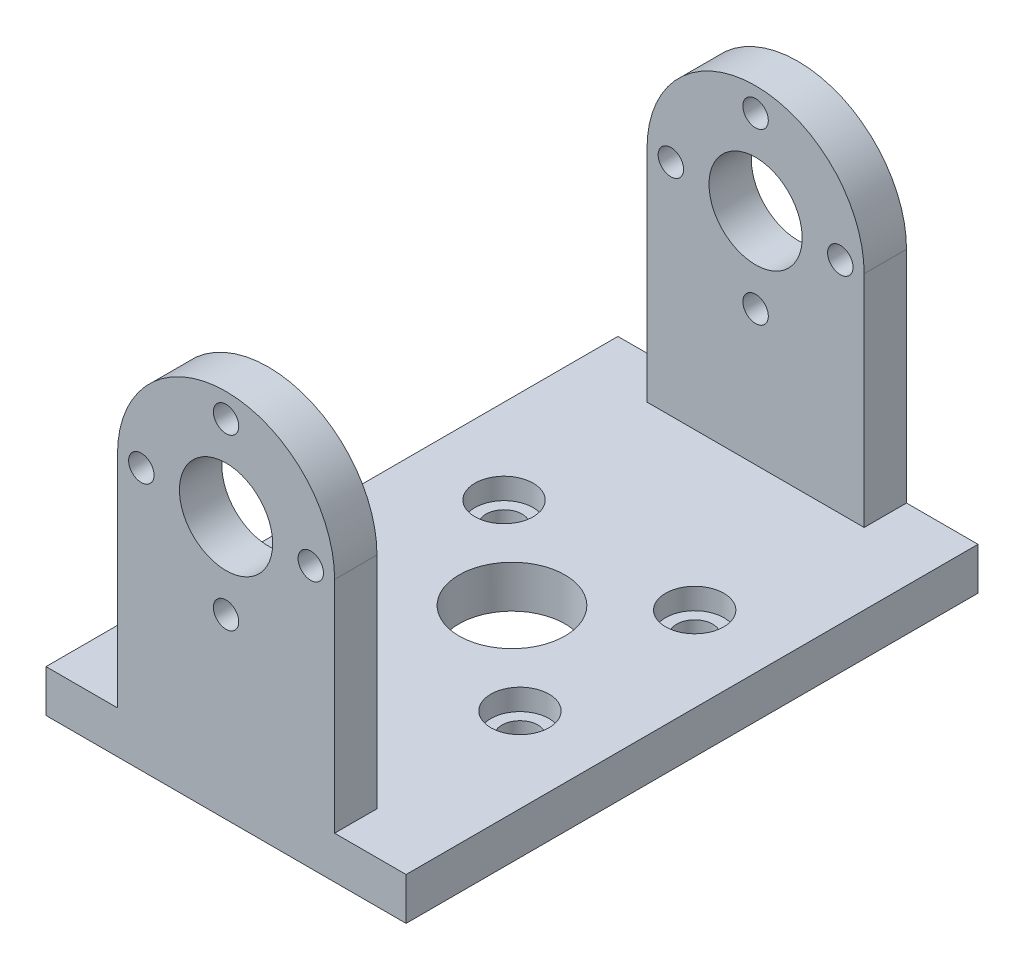
from build123d import *
from build123d.topology import SkipClean

# Parameters (mm, degrees)
SKETCH1_R                 = 1.2
SKETCH1_R_2               = 4.4
BOSS_EXTRUDE1_DEPTH       = 4
SKETCH3_W                 = 34
SKETCH3_H                 = 46
SKETCH3_R                 = 5
SKETCH3_R_2               = 1.7
BOSS_EXTRUDE3_DEPTH       = 4
SKETCH4_R                 = 1.7
SKETCH4_R_2               = 5
BOSS_EXTRUDE4_DEPTH       = 4
SKETCH5_W                 = 46
SKETCH5_H                 = 4
CUT_EXTRUDE1_DEPTH        = 65.020016401
SKETCH6_R                 = 2.75
CUT_EXTRUDE2_DEPTH        = 2
SKETCH7_W                 = 34
SKETCH7_H                 = 4
BOSS_EXTRUDE5_DEPTH       = 4
MIRROR3_COPY_1_SKETCH_R   = 1.2
MIRROR3_COPY_1_SKETCH_R_2 = 4.4
MIRROR3_COPY_1_DEPTH      = 4
MIRROR3_COPY_2_SKETCH_R   = 1.2
MIRROR3_COPY_2_SKETCH_R_2 = 4.4
MIRROR3_COPY_2_DEPTH      = 4
SKETCH8_W                 = 54
SKETCH8_H                 = 4
SKETCH8_W_2               = 46
SKETCH8_H_2               = 31
CUT_EXTRUDE3_DEPTH        = 67.951941719


with BuildPart() as part:
    # Sketch1 → Boss-Extrude1 (new body)
    with BuildSketch(Plane.XY):
        with BuildLine():
            Line((-10.25, -28.75), (10.25, -28.75))
            Line((10.25, -28.75), (10.25, 0))
            ThreePointArc((10.25, 0), (0, 10.25), (-10.25, 0))
            Line((-10.25, 0), (-10.25, -28.75))
        make_face()
        with Locations((0, 8)):
            Circle(SKETCH1_R, mode=Mode.SUBTRACT)
        with Locations((-8, 0)):
            Circle(SKETCH1_R, mode=Mode.SUBTRACT)
        with Locations((0, -8)):
            Circle(SKETCH1_R, mode=Mode.SUBTRACT)
        with Locations((8, 0)):
            Circle(SKETCH1_R, mode=Mode.SUBTRACT)
        Circle(SKETCH1_R_2, mode=Mode.SUBTRACT)
    boss_extrude1 = extrude(amount=BOSS_EXTRUDE1_DEPTH)

    # Sketch3 → Boss-Extrude3 (add)
    with BuildSketch(Plane(origin=(0, -28.75, 0), x_dir=(-1, 0, 0), z_dir=(0, -1, 0))):
        with Locations((0, -23)):
            Rectangle(SKETCH3_W, SKETCH3_H)
        with Locations((0, -23)):
            Circle(SKETCH3_R, mode=Mode.SUBTRACT)
        with Locations((-9, -14.75)):
            Circle(SKETCH3_R_2, mode=Mode.SUBTRACT)
        with Locations((9, -14.75)):
            Circle(SKETCH3_R_2, mode=Mode.SUBTRACT)
        with Locations((9, -31.25)):
            Circle(SKETCH3_R_2, mode=Mode.SUBTRACT)
        with Locations((-9, -31.25)):
            Circle(SKETCH3_R_2, mode=Mode.SUBTRACT)
    extrude(amount=-BOSS_EXTRUDE3_DEPTH)

    # Mirror1: Boss-Extrude1 across plane
    add(boss_extrude1.mirror(Plane.XY.offset(23)))

    # Sketch4 → Boss-Extrude4 (add)
    with SkipClean():  # the faces are left unmerged after this step: merging them gives an invalid solid
        with BuildSketch(Plane(origin=(0, -24.75, 0), x_dir=(1, 0, 0), z_dir=(0, 1, 0))):
            Polygon((-17, 0), (-17, -46), (-10.25, -46), (-10.25, -42), (10.25, -42), (10.25, -46), (17, -46), (17, 0), (10.25, 0), (10.25, -4), (-10.25, -4), (-10.25, 0), align=None)
            with Locations((-9, -31.25)):
                Circle(SKETCH4_R, mode=Mode.SUBTRACT)
            with Locations((9, -31.25)):
                Circle(SKETCH4_R, mode=Mode.SUBTRACT)
            with Locations((-9, -14.75)):
                Circle(SKETCH4_R, mode=Mode.SUBTRACT)
            with Locations((0, -23)):
                Circle(SKETCH4_R_2, mode=Mode.SUBTRACT)
            with Locations((9, -14.75)):
                Circle(SKETCH4_R, mode=Mode.SUBTRACT)
        extrude(amount=BOSS_EXTRUDE4_DEPTH)

    # Sketch5 → Cut-Extrude1 (cut, through all)
    with BuildSketch(Plane.ZY.offset(17)):
        with Locations((23, -26.75)):
            Rectangle(SKETCH5_W, SKETCH5_H)
    extrude(amount=-CUT_EXTRUDE1_DEPTH, mode=Mode.SUBTRACT)

    # Sketch6 → Cut-Extrude2 (cut)
    with BuildSketch(Plane(origin=(0, -20.75, 0), x_dir=(1, 0, 0), z_dir=(0, 1, 0))):
        with Locations((-9, -14.75)):
            Circle(SKETCH6_R)
        with Locations((9, -14.75)):
            Circle(SKETCH6_R)
        with Locations((9, -31.25)):
            Circle(SKETCH6_R)
        with Locations((-9, -31.25)):
            Circle(SKETCH6_R)
    extrude(amount=-CUT_EXTRUDE2_DEPTH, mode=Mode.SUBTRACT)

    # Sketch7 → Boss-Extrude5 (add)
    with BuildSketch(Plane(origin=(0, -20.75, 0), x_dir=(1, 0, 0), z_dir=(0, 1, 0))):
        with Locations((0, 2)):
            Rectangle(SKETCH7_W, SKETCH7_H)
        with Locations((0, -48)):
            Rectangle(SKETCH7_W, SKETCH7_H)
    extrude(amount=-BOSS_EXTRUDE5_DEPTH)

    # Mirror2: Boss-Extrude1 across plane
    add(boss_extrude1.mirror(Plane(origin=(0, 0, 0), x_dir=(1, 0, 0), z_dir=(0, 0, -1))))

    # Mirror3 copy 1 sketch → Mirror3 copy 1 (add)
    with BuildSketch(Plane.XY.offset(46)):
        with BuildLine():
            Line((-10.25, -28.75), (10.25, -28.75))
            Line((10.25, -28.75), (10.25, 0))
            ThreePointArc((10.25, 0), (0, 10.25), (-10.25, 0))
            Line((-10.25, 0), (-10.25, -28.75))
        make_face()
        with Locations((0, 8)):
            Circle(MIRROR3_COPY_1_SKETCH_R, mode=Mode.SUBTRACT)
        with Locations((-8, 0)):
            Circle(MIRROR3_COPY_1_SKETCH_R, mode=Mode.SUBTRACT)
        with Locations((0, -8)):
            Circle(MIRROR3_COPY_1_SKETCH_R, mode=Mode.SUBTRACT)
        with Locations((8, 0)):
            Circle(MIRROR3_COPY_1_SKETCH_R, mode=Mode.SUBTRACT)
        Circle(MIRROR3_COPY_1_SKETCH_R_2, mode=Mode.SUBTRACT)
    extrude(amount=MIRROR3_COPY_1_DEPTH)

    # Mirror3 copy 2 sketch → Mirror3 copy 2 (add)
    with BuildSketch(Plane(origin=(0, 0, 46), x_dir=(1, 0, 0), z_dir=(0, 0, -1))):
        with BuildLine():
            Line((-10.25, 28.75), (10.25, 28.75))
            Line((10.25, 28.75), (10.25, 0))
            ThreePointArc((10.25, 0), (0, -10.25), (-10.25, 0))
            Line((-10.25, 0), (-10.25, 28.75))
        make_face()
        with Locations((0, -8)):
            Circle(MIRROR3_COPY_2_SKETCH_R, mode=Mode.SUBTRACT)
        with Locations((-8, 0)):
            Circle(MIRROR3_COPY_2_SKETCH_R, mode=Mode.SUBTRACT)
        with Locations((0, 8)):
            Circle(MIRROR3_COPY_2_SKETCH_R, mode=Mode.SUBTRACT)
        with Locations((8, 0)):
            Circle(MIRROR3_COPY_2_SKETCH_R, mode=Mode.SUBTRACT)
        Circle(MIRROR3_COPY_2_SKETCH_R_2, mode=Mode.SUBTRACT)
    extrude(amount=MIRROR3_COPY_2_DEPTH)

    # Sketch8 → Cut-Extrude3 (cut, through all)
    with BuildSketch(Plane(origin=(17, 0, 0), x_dir=(0, 0, -1), z_dir=(1, 0, 0))):
        with Locations((-23, -26.75)):
            Rectangle(SKETCH8_W, SKETCH8_H)
        with Locations((-23, -5.25)):
            Rectangle(SKETCH8_W_2, SKETCH8_H_2)
    extrude(amount=-CUT_EXTRUDE3_DEPTH, mode=Mode.SUBTRACT)


solid = part.part
